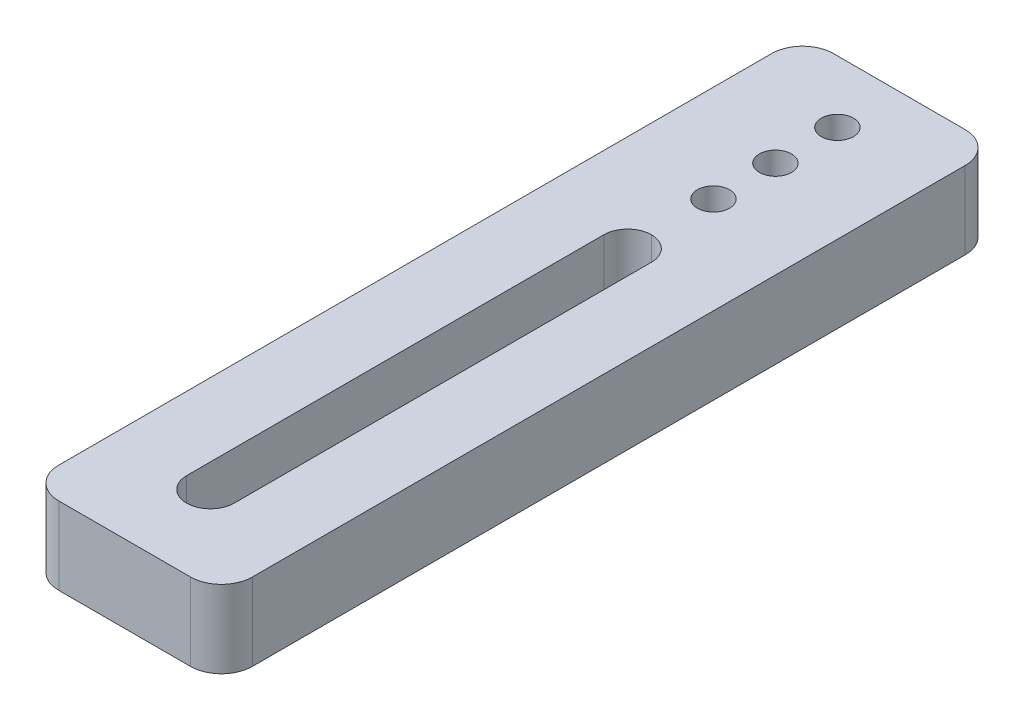
from build123d import *

# Parameters (mm, degrees)
SKETCH1_W                    = 25
SKETCH1_H                    = 100
BOSS_EXTRUDE1_DEPTH          = 10
CUT_EXTRUDE_THIN2_DEPTH      = 53.5
CUT_EXTRUDE_THIN2_DEPTH_BACK = 10
SKETCH3_W                    = 6.15
SKETCH3_H                    = 60
FILLET2_R                    = 3.075
FILLET3_R                    = 4
SKETCH4_R                    = 2.075
CUT_EXTRUDE1_DEPTH           = 53.5
LPATTERN1_COUNT              = 3
LPATTERN1_PITCH              = 8


with BuildPart() as part:
    # Sketch1 → Boss-Extrude1 (new body)
    with BuildSketch(Plane(origin=(0, 0, 0), x_dir=(1, 0, 0), z_dir=(0, 1, 0))):
        Rectangle(SKETCH1_W, SKETCH1_H)
    extrude(amount=BOSS_EXTRUDE1_DEPTH)

    # Sketch3 → Cut-Extrude-Thin2 (cut, two sides: drawn at the far end of the back side and taken through both)
    with BuildSketch(Plane(origin=(0, 10, 0), x_dir=(1, 0, 0), z_dir=(0, 1, 0)).offset(-CUT_EXTRUDE_THIN2_DEPTH_BACK)):
        with Locations((0, -12)):
            Rectangle(SKETCH3_W, SKETCH3_H)
    extrude(amount=CUT_EXTRUDE_THIN2_DEPTH + CUT_EXTRUDE_THIN2_DEPTH_BACK, mode=Mode.SUBTRACT)

    # Fillet2
    fillet2_edges = [part.edges().sort_by_distance(p)[0] for p in [
        (3.075, 5, -18),
        (-3.075, 5, -18),
        (3.075, 5, 42),
        (-3.075, 5, 42),
    ]]
    fillet(fillet2_edges, radius=FILLET2_R - 0.0001)  # a hair under: the kernel refuses the full size

    # Fillet3
    fillet3_edges = [part.edges().sort_by_distance(p)[0] for p in [
        (12.5, 5, 50),
        (-12.5, 5, 50),
        (-12.5, 5, -50),
        (12.5, 5, -50),
    ]]
    fillet(fillet3_edges, radius=FILLET3_R)

    # Sketch4 → Cut-Extrude1 (cut, through all)
    with BuildSketch(Plane(origin=(0, 10, 0), x_dir=(1, 0, 0), z_dir=(0, 1, 0))):
        with Locations(Location((0, 42, 0), (0, 0, 270))):
            Circle(SKETCH4_R)
    cut_extrude1 = extrude(amount=-CUT_EXTRUDE1_DEPTH, mode=Mode.SUBTRACT)

    # LPattern1: Cut-Extrude1 ×3
    with Locations(*[(0, 0, i * LPATTERN1_PITCH) for i in range(1, LPATTERN1_COUNT)]):
        add(cut_extrude1, mode=Mode.SUBTRACT)


solid = part.part
